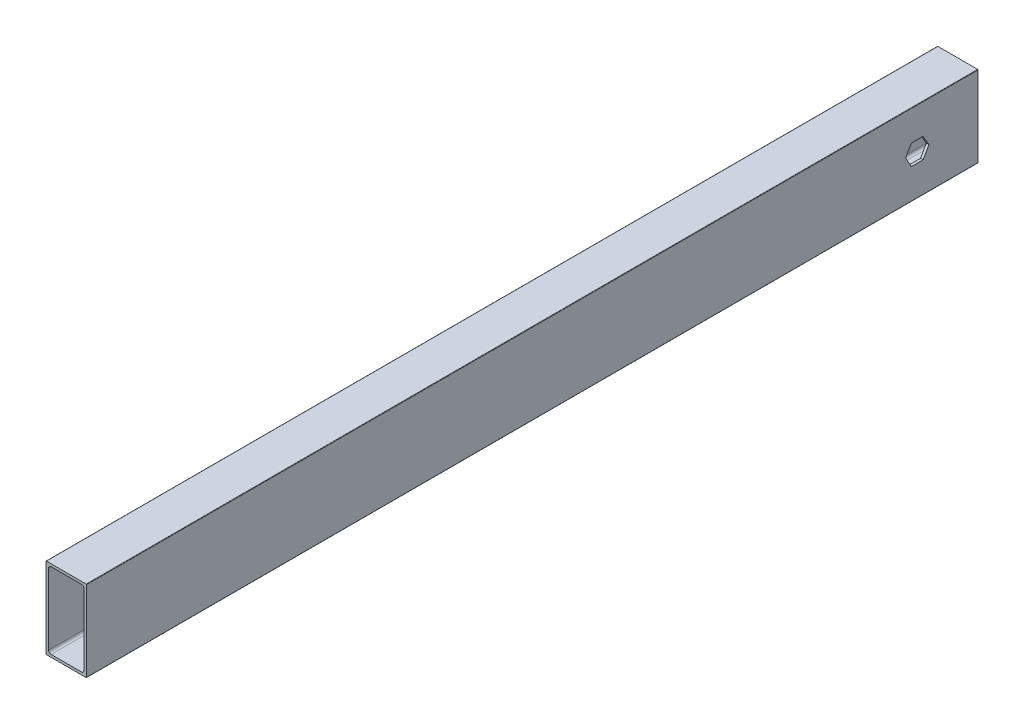
from build123d import *

# Parameters (mm, degrees)
BOSS_EXTRUDE1_DEPTH = 558.8
CUT_EXTRUDE1_DEPTH  = 25.4


with BuildPart() as part:
    # Sketch1 → Boss-Extrude1 (new body)
    with BuildSketch(Plane(origin=(0, 0, 0), x_dir=(-1, 0, 0), z_dir=(0, 0, -1))):
        with BuildLine():
            Line((-12.7, 25.146), (-12.7, -25.146))
            ThreePointArc((-12.7, -25.146), (-12.625605122, -25.325605122), (-12.446, -25.4))
            Line((-12.446, -25.4), (12.446, -25.4))
            ThreePointArc((12.446, -25.4), (12.625605122, -25.325605122), (12.7, -25.146))
            Line((12.7, -25.146), (12.7, 25.146))
            ThreePointArc((12.7, 25.146), (12.625605122, 25.325605122), (12.446, 25.4))
            Line((12.446, 25.4), (-12.446, 25.4))
            ThreePointArc((-12.446, 25.4), (-12.625605122, 25.325605122), (-12.7, 25.146))
        make_face()
        with BuildLine():
            Line((-11.1125, -22.225), (-11.1125, 22.225))
            ThreePointArc((-11.1125, 22.225), (-10.647532015, 23.347532015), (-9.525, 23.8125))
            Line((-9.525, 23.8125), (9.525, 23.8125))
            ThreePointArc((9.525, 23.8125), (10.647532015, 23.347532015), (11.1125, 22.225))
            Line((11.1125, 22.225), (11.1125, -22.225))
            ThreePointArc((11.1125, -22.225), (10.647532015, -23.347532015), (9.525, -23.8125))
            Line((9.525, -23.8125), (-9.525, -23.8125))
            ThreePointArc((-9.525, -23.8125), (-10.647532015, -23.347532015), (-11.1125, -22.225))
        make_face(mode=Mode.SUBTRACT)
    extrude(amount=-BOSS_EXTRUDE1_DEPTH)

    # Sketch2 → Cut-Extrude1 (cut)
    with BuildSketch(Plane.ZY.offset(12.7)):
        Polygon((45.432348419, 0), (41.766174209, 6.35), (34.433825791, 6.35), (30.767651581, 0), (34.433825791, -6.35), (41.766174209, -6.35), align=None)
    extrude(amount=-CUT_EXTRUDE1_DEPTH, mode=Mode.SUBTRACT)


solid = part.part
